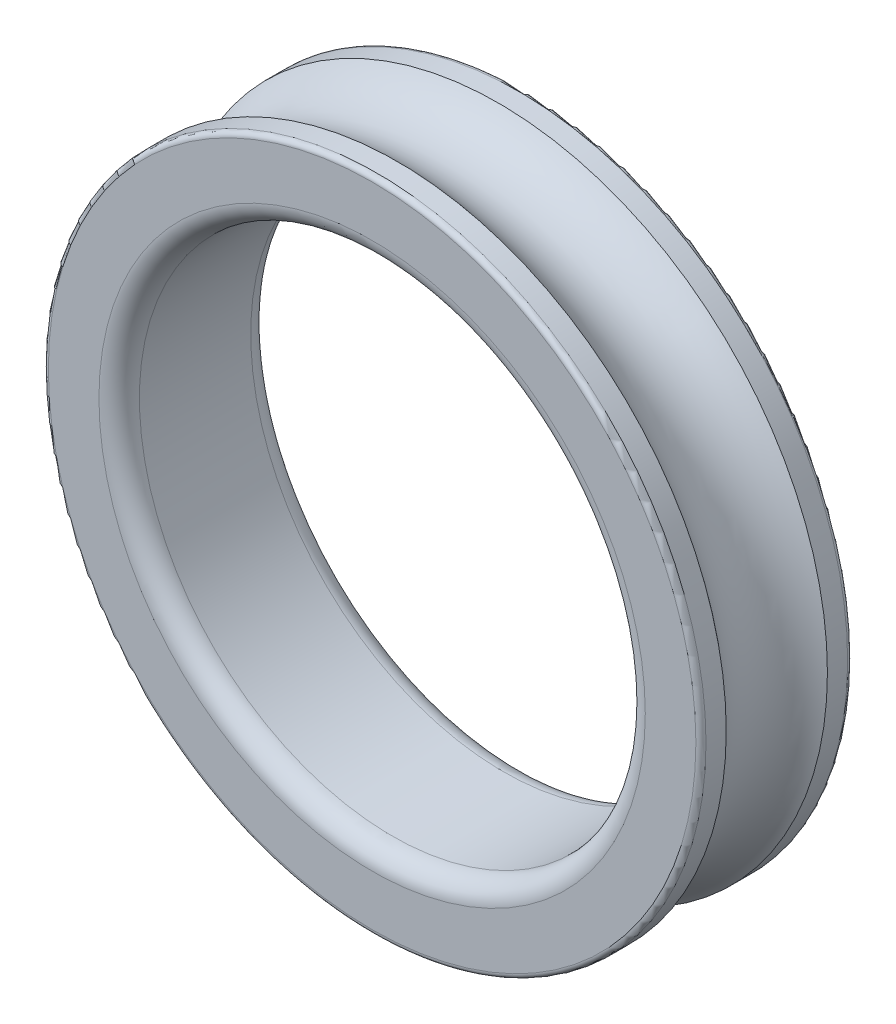
from build123d import *

# Parameters (mm, degrees)
SKETCH_1_R      = 13
SKETCH_1_R_2    = 10
EXTRUDE_1_DEPTH = 6
FILLET_1_R      = 0.8
FILLET_2_R      = 0.2


# Read off the part's stored shape, not the designer's step: 压凹5
with BuildPart() as part:
    # 草图1 → 凸台-拉伸1 (new body)
    with BuildSketch(Plane.XY):
        Circle(SKETCH_1_R)
        Circle(SKETCH_1_R_2, mode=Mode.SUBTRACT)
    extrude(amount=EXTRUDE_1_DEPTH)

    # 压凹5 outline → 压凹5 (revolve, cut)
    with BuildSketch(Plane.XZ):
        with BuildLine():
            Line((13, 1), (13, 5))
            ThreePointArc((13, 5), (12, 3), (13, 1))
        make_face()
    revolve(axis=Axis((0, 0, 0), (0, 0, 1)), mode=Mode.SUBTRACT)

    # 圆角1
    fillet_1_edges = [part.edges().sort_by_distance(p)[0] for p in [
        (-10, 0, 0),
        (-10, 0, 6),
    ]]
    fillet(fillet_1_edges, radius=FILLET_1_R)

    # 圆角2
    fillet_2_edges = [part.edges().sort_by_distance(p)[0] for p in [
        (-13, 0, 0),
        (-13, 0, 6),
    ]]
    fillet(fillet_2_edges, radius=FILLET_2_R)


solid = part.part
